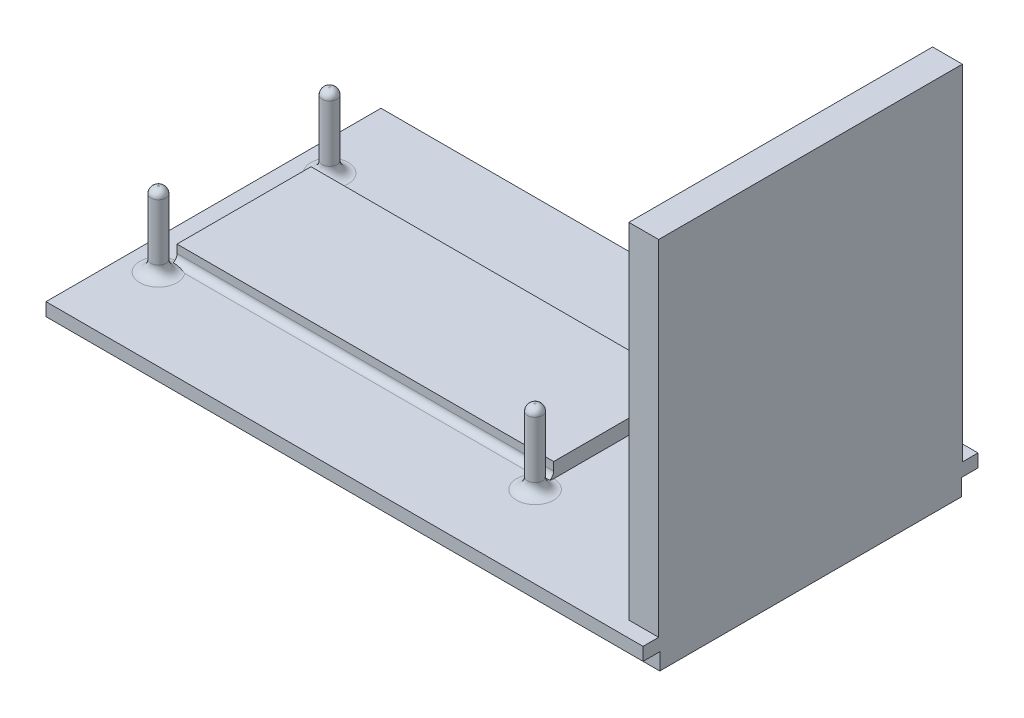
from build123d import *

# Parameters (mm, degrees)
BOSS_EXTRU_4_DEPTH           = 80.2
ENL_V_MAT_EXTRU_5_DEPTH      = 91.970338573
ENL_V_MAT_EXTRU_5_DEPTH_BACK = 91.970338573
ESQUISSE10_W                 = 2.1
ESQUISSE10_H                 = 2.25
ESQUISSE11_W                 = 40.8
ESQUISSE11_H                 = 45.5
BOSS_EXTRU_5_DEPTH           = 4
ESQUISSE12_W                 = 4
ESQUISSE12_H                 = 40.8
BOSS_EXTRU_6_DEPTH           = 0.78
ESQUISSE13_R                 = 1
BOSS_EXTRU_7_DEPTH           = 10
CONG_1_R                     = 1.5
CONG_5_R                     = 0.9
ESQUISSE14_W                 = 50.6
ESQUISSE14_H                 = 18
BOSS_EXTRU_8_DEPTH           = 2
CONG_7_START                 = 4.1
CONG_7_DEPTH                 = 50.6


with BuildPart() as part:
    # Esquisse9 → Boss.-Extru.4 (new body)
    with BuildSketch(Plane(origin=(0, 0, 0), x_dir=(0, 0, -1), z_dir=(1, 0, 0))):
        Polygon((2.25, 2.25), (2.25, 0), (42.75, 0), (42.75, 2.25), (45, 2.25), (45, 4), (0, 4), (0, 2.25), align=None)
    extrude(amount=BOSS_EXTRU_4_DEPTH)

    # Esquisse10 → Enlèv. mat.-Extru.5 (cut, two sides: drawn at the far end of the back side and taken through both)
    with BuildSketch(Plane.XY.offset(-2.25).offset(-ENL_V_MAT_EXTRU_5_DEPTH_BACK)):
        with Locations((1.05, 1.125)):
            Rectangle(ESQUISSE10_W, ESQUISSE10_H)
    extrude(amount=ENL_V_MAT_EXTRU_5_DEPTH + ENL_V_MAT_EXTRU_5_DEPTH_BACK, mode=Mode.SUBTRACT)

    # Esquisse11 → Boss.-Extru.5 (add)
    with BuildSketch(Plane(origin=(80.2, 0, 0), x_dir=(0, 0, -1), z_dir=(1, 0, 0))):
        with Locations((22.5, 26.75)):
            Rectangle(ESQUISSE11_W, ESQUISSE11_H)
    extrude(amount=-BOSS_EXTRU_5_DEPTH)

    # Esquisse12 → Boss.-Extru.6 (add)
    with BuildSketch(Plane(origin=(0, 49.5, 0), x_dir=(1, 0, 0), z_dir=(0, 1, 0))):
        with Locations((78.2, 22.5)):
            Rectangle(ESQUISSE12_W, ESQUISSE12_H)
    extrude(amount=BOSS_EXTRU_6_DEPTH)

    # Esquisse13 → Boss.-Extru.7 (add)
    with BuildSketch(Plane(origin=(0, 4, 0), x_dir=(1, 0, 0), z_dir=(0, 1, 0))):
        with Locations(Location((4.1, 34, 0), (0, 0, 270))):
            Circle(ESQUISSE13_R)
        with Locations(Location((4.1, 11, 0), (0, 0, 270))):
            Circle(ESQUISSE13_R)
        with Locations(Location((54.7, 11, 0), (0, 0, 270))):
            Circle(ESQUISSE13_R)
        with Locations(Location((54.7, 34, 0), (0, 0, 270))):
            Circle(ESQUISSE13_R)
    extrude(amount=BOSS_EXTRU_7_DEPTH)

    # Congé1
    cong_1_edges = [part.edges().sort_by_distance(p)[0] for p in [
        (54.7, 4, -35),
        (54.7, 4, -12),
        (4.1, 4, -12),
        (4.1, 4, -35),
    ]]
    fillet(cong_1_edges, radius=CONG_1_R)

    # Congé5
    cong_5_edges = [part.edges().sort_by_distance(p)[0] for p in [
        (54.7, 14, -35),
        (54.7, 14, -12),
        (4.1, 14, -12),
        (4.1, 14, -35),
    ]]
    fillet(cong_5_edges, radius=CONG_5_R)

    # Esquisse14 → Boss.-Extru.8 (add)
    with BuildSketch(Plane(origin=(0, 4, 0), x_dir=(1, 0, 0), z_dir=(0, 1, 0))):
        with Locations((29.4, 22.5)):
            Rectangle(ESQUISSE14_W, ESQUISSE14_H)
    extrude(amount=BOSS_EXTRU_8_DEPTH)

    # Congé7: read off the stored shape, not the designer's step
    # Congé7 outline → Congé7 (add)
    with BuildSketch(Plane.YZ.offset(CONG_7_START)):
        with BuildLine():
            Line((4, -31.5), (4, -32.4))
            ThreePointArc((4, -32.4), (4.263603897, -31.763603897), (4.9, -31.5))
            Line((4.9, -31.5), (4, -31.5))
        make_face()
        with BuildLine():
            Line((4, -12.6), (4, -13.5))
            Line((4, -13.5), (4.9, -13.5))
            ThreePointArc((4.9, -13.5), (4.263603897, -13.236396103), (4, -12.6))
        make_face()
    extrude(amount=CONG_7_DEPTH)


solid = part.part
